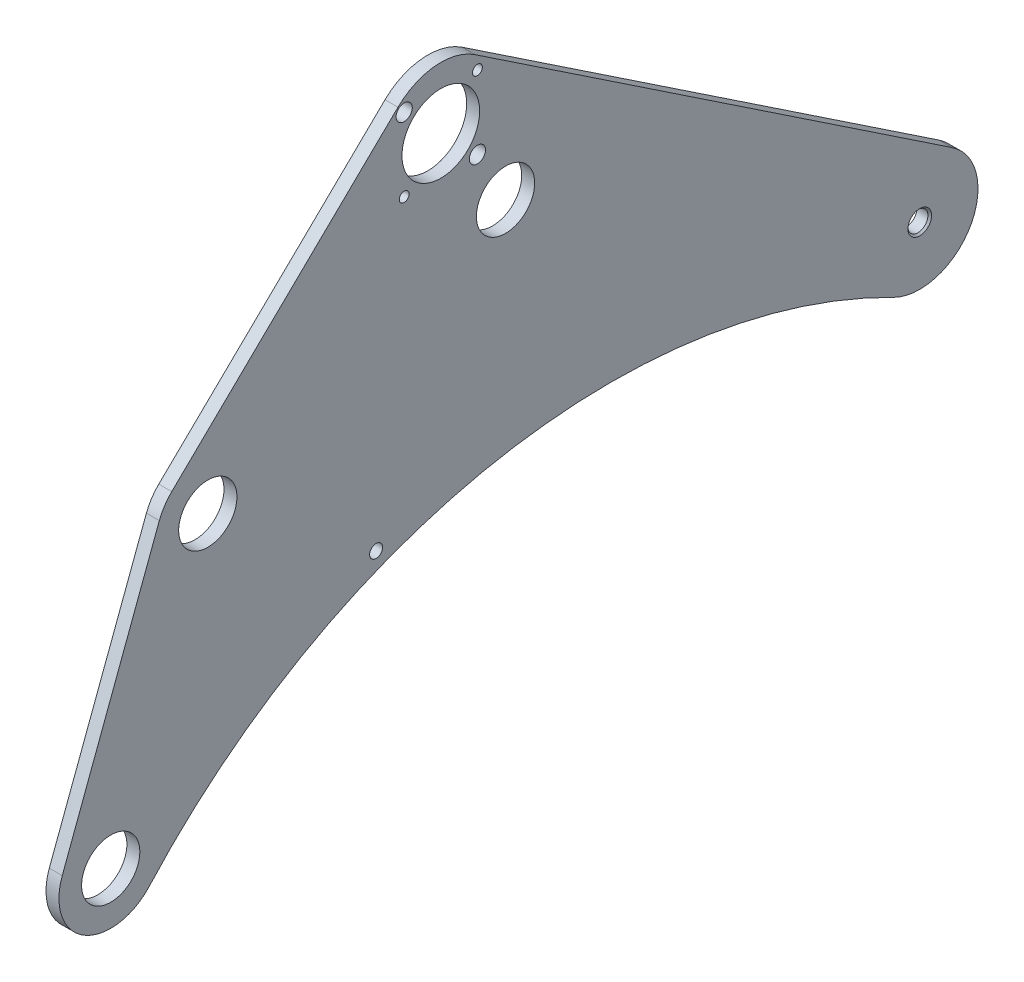
from build123d import *

# Parameters (mm, degrees)
BOSS_EXTRUDE1_DEPTH               = 6.35
CUT_EXTRUDE1_REACH                = 463.209
SKETCH3_R                         = 14.2875
SKETCH3_R_2                       = 19.05
SKETCH3_R_3                       = 2.413
SKETCH3_R_4                       = 3.96875
F_3_8_CLEARANCE_HOLE2_D           = 9.8044
F_3_8_CLEARANCE_HOLE2_CSINK_D     = 11.58748
F_3_8_CLEARANCE_HOLE2_CSINK_ANGLE = 90
F_1_4_0_2500_DOWEL_HOLE2_D        = 6.35


with BuildPart() as part:
    # Sketch2 → Boss-Extrude1 (new body)
    with BuildSketch(Plane(origin=(0, 0, 0), x_dir=(0, 0, -1), z_dir=(1, 0, 0))):
        with BuildLine():
            Line((-420.65776111, -67.281464584), (-373.03276111, 59.718535416))
            ThreePointArc((-373.03276111, 59.718535416), (-370.505449055, 64.705606261), (-366.948304567, 69.018946606))
            Line((-366.948304567, 69.018946606), (-255.966736674, 176.828999095))
            ThreePointArc((-255.966736674, 176.828999095), (-237.683735505, 185.232360415), (-218.184119534, 180.26752505))
            Line((-218.184119534, 180.26752505), (15.883465704, 23.753865837))
            ThreePointArc((15.883465704, 23.753865837), (24.649476553, -14.454547059), (-12.975284095, -25.459234624))
            ThreePointArc((-12.975284095, -25.459234624), (-206.983757432, 2.660555148), (-377.990639572, -93.186492612))
            ThreePointArc((-377.990639572, -93.186492612), (-410.057040874, -97.911605155), (-420.65776111, -67.281464584))
        make_face()
    extrude(amount=BOSS_EXTRUDE1_DEPTH)

    # Sketch3 → Cut-Extrude1 (cut, up to next)
    with BuildSketch(Plane(origin=(6.35, 0, 0), x_dir=(0, 0, -1), z_dir=(1, 0, 0)), mode=Mode.PRIVATE) as cut_extrude1_sk1:
        with Locations((-203.2, 111.125)):
            Circle(SKETCH3_R)
    cut_extrude1_tool1 = extrude(cut_extrude1_sk1.sketch, amount=-CUT_EXTRUDE1_REACH, mode=Mode.PRIVATE) & part.part
    # Sketch3 → Cut-Extrude1 (cut, up to next)
    with BuildSketch(Plane(origin=(6.35, 0, 0), x_dir=(0, 0, -1), z_dir=(1, 0, 0)), mode=Mode.PRIVATE) as cut_extrude1_sk2:
        with Locations((-349.25, 50.8)):
            Circle(SKETCH3_R)
    cut_extrude1_tool2 = extrude(cut_extrude1_sk2.sketch, amount=-CUT_EXTRUDE1_REACH, mode=Mode.PRIVATE) & part.part
    # Sketch3 → Cut-Extrude1 (cut, up to next)
    with BuildSketch(Plane(origin=(6.35, 0, 0), x_dir=(0, 0, -1), z_dir=(1, 0, 0)), mode=Mode.PRIVATE) as cut_extrude1_sk3:
        with Locations((-396.875, -76.2)):
            Circle(SKETCH3_R)
    cut_extrude1_tool3 = extrude(cut_extrude1_sk3.sketch, amount=-CUT_EXTRUDE1_REACH, mode=Mode.PRIVATE) & part.part
    # Sketch3 → Cut-Extrude1 (cut, up to next)
    with BuildSketch(Plane(origin=(6.35, 0, 0), x_dir=(0, 0, -1), z_dir=(1, 0, 0)), mode=Mode.PRIVATE) as cut_extrude1_sk4:
        with Locations((-234.95, 155.194)):
            Circle(SKETCH3_R_2)
    cut_extrude1_tool4 = extrude(cut_extrude1_sk4.sketch, amount=-CUT_EXTRUDE1_REACH, mode=Mode.PRIVATE) & part.part
    # Sketch3 → Cut-Extrude1 (cut, up to next)
    with BuildSketch(Plane(origin=(6.35, 0, 0), x_dir=(0, 0, -1), z_dir=(1, 0, 0)), mode=Mode.PRIVATE) as cut_extrude1_sk5:
        with Locations((-252.910512242, 137.233487758)):
            Circle(SKETCH3_R_3)
    cut_extrude1_tool5 = extrude(cut_extrude1_sk5.sketch, amount=-CUT_EXTRUDE1_REACH, mode=Mode.PRIVATE) & part.part
    # Sketch3 → Cut-Extrude1 (cut, up to next)
    with BuildSketch(Plane(origin=(6.35, 0, 0), x_dir=(0, 0, -1), z_dir=(1, 0, 0)), mode=Mode.PRIVATE) as cut_extrude1_sk6:
        with Locations((-216.989487758, 137.233487758)):
            Circle(SKETCH3_R_4)
    cut_extrude1_tool6 = extrude(cut_extrude1_sk6.sketch, amount=-CUT_EXTRUDE1_REACH, mode=Mode.PRIVATE) & part.part
    # Sketch3 → Cut-Extrude1 (cut, up to next)
    with BuildSketch(Plane(origin=(6.35, 0, 0), x_dir=(0, 0, -1), z_dir=(1, 0, 0)), mode=Mode.PRIVATE) as cut_extrude1_sk7:
        with Locations((-216.989487758, 173.154512242)):
            Circle(SKETCH3_R_3)
    cut_extrude1_tool7 = extrude(cut_extrude1_sk7.sketch, amount=-CUT_EXTRUDE1_REACH, mode=Mode.PRIVATE) & part.part
    # Sketch3 → Cut-Extrude1 (cut, up to next)
    with BuildSketch(Plane(origin=(6.35, 0, 0), x_dir=(0, 0, -1), z_dir=(1, 0, 0)), mode=Mode.PRIVATE) as cut_extrude1_sk8:
        with Locations((-252.910512242, 173.154512242)):
            Circle(SKETCH3_R_4)
    cut_extrude1_tool8 = extrude(cut_extrude1_sk8.sketch, amount=-CUT_EXTRUDE1_REACH, mode=Mode.PRIVATE) & part.part
    add(cut_extrude1_tool1.solids().sort_by_distance((6.35, 111.125, 203.2))[0], mode=Mode.SUBTRACT)
    add(cut_extrude1_tool2.solids().sort_by_distance((6.35, 50.8, 349.25))[0], mode=Mode.SUBTRACT)
    add(cut_extrude1_tool3.solids().sort_by_distance((6.35, -76.2, 396.875))[0], mode=Mode.SUBTRACT)
    add(cut_extrude1_tool4.solids().sort_by_distance((6.35, 155.194, 234.95))[0], mode=Mode.SUBTRACT)
    add(cut_extrude1_tool5.solids().sort_by_distance((6.35, 137.233488, 252.910512))[0], mode=Mode.SUBTRACT)
    add(cut_extrude1_tool6.solids().sort_by_distance((6.35, 137.233488, 216.989488))[0], mode=Mode.SUBTRACT)
    add(cut_extrude1_tool7.solids().sort_by_distance((6.35, 173.154512, 216.989488))[0], mode=Mode.SUBTRACT)
    add(cut_extrude1_tool8.solids().sort_by_distance((6.35, 173.154512, 252.910512))[0], mode=Mode.SUBTRACT)

    # 3/8 Clearance Hole2 (through all)
    with Locations(Plane(origin=(6.35, 0, 0), x_dir=(0, 0, -1), z_dir=(1, 0, 0))):
        with Locations((0, 0)):
            CounterSinkHole(F_3_8_CLEARANCE_HOLE2_D / 2, F_3_8_CLEARANCE_HOLE2_CSINK_D / 2, counter_sink_angle=F_3_8_CLEARANCE_HOLE2_CSINK_ANGLE)

    # 1/4 (0.2500) Dowel Hole2 (through all)
    with Locations(Plane(origin=(6.35, 0, 0), x_dir=(0, 0, -1), z_dir=(1, 0, 0))):
        with Locations((-266.7, -6.35)):
            Hole(F_1_4_0_2500_DOWEL_HOLE2_D / 2)


solid = part.part
